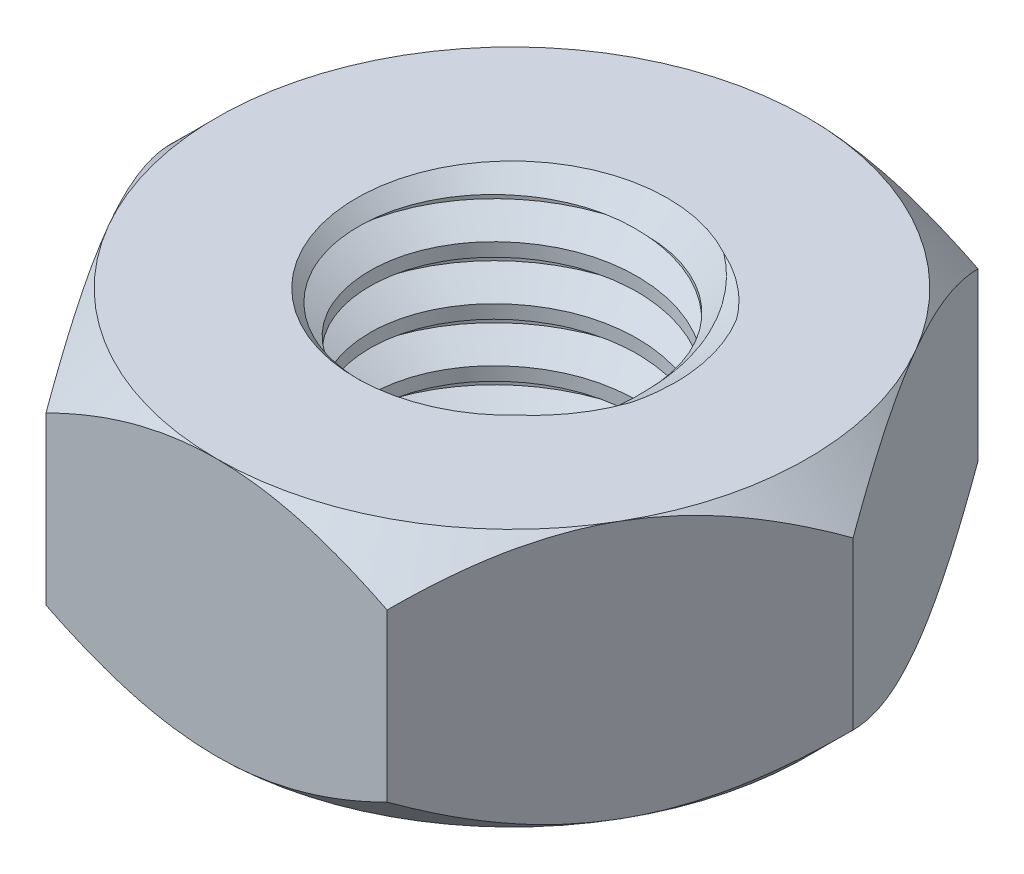
from build123d import *

# Parameters (mm, degrees)
BOSS_EXTRUDE1_DEPTH = 2.4
SKETCH2_OUTSIDE_W   = 21.774
SKETCH2_OUTSIDE_H   = 20.924
SKETCH2_OUTSIDE_R   = 2.75
CUT_EXTRUDE1_DEPTH  = 5.837957558
CUT_EXTRUDE1_DRAFT  = -45
SKETCH3_OUTSIDE_W   = 21.774
SKETCH3_OUTSIDE_H   = 20.924
SKETCH3_OUTSIDE_R   = 2.75
CUT_EXTRUDE2_DEPTH  = 5.837957558
CUT_EXTRUDE2_DRAFT  = -45
SKETCH4_R           = 1.25
CUT_EXTRUDE3_DEPTH  = 5.837957558
CHAMFER1_SIZE       = 0.2
THREAD1_PITCH       = 0.5


with BuildPart() as part:
    # Sketch1 → Boss-Extrude1 (new body)
    with BuildSketch(Plane(origin=(0, 0, 0), x_dir=(1, 0, 0), z_dir=(0, 1, 0))):
        Polygon((3.175426481, 0), (1.58771324, 2.75), (-1.58771324, 2.75), (-3.175426481, 0), (-1.58771324, -2.75), (1.58771324, -2.75), align=None)
    extrude(amount=BOSS_EXTRUDE1_DEPTH)


with BuildPart() as cut_extrude1_tool:
    # Sketch2 outside → Cut-Extrude1 (with draft: the straight prism first)
    with BuildSketch(Plane(origin=(0, 2.4, 0), x_dir=(1, 0, 0), z_dir=(0, 1, 0))):
        Rectangle(SKETCH2_OUTSIDE_W, SKETCH2_OUTSIDE_H)
        Circle(SKETCH2_OUTSIDE_R, mode=Mode.SUBTRACT)
    extrude(amount=-CUT_EXTRUDE1_DEPTH)
    # Cut-Extrude1: the draft: its side faces are tilted about the plane it starts from
    cut_extrude1_sides = [cut_extrude1_tool.faces().sort_by_distance(p)[0] for p in [
        (0, -0.518978779, 10.462),
        (10.887, -0.518978779, 0),
        (0, -0.518978779, -10.462),
        (-10.887, -0.518978779, 0),
        (-2.75, -0.518978779, 0),
    ]]
    draft(cut_extrude1_sides, Plane(origin=(0, 2.4, 0), x_dir=(1, 0, 0), z_dir=(0, 1, 0)), CUT_EXTRUDE1_DRAFT)


with BuildPart() as part_1:
    add(part.part)

    # Cut-Extrude1: cut by cut_extrude1_tool
    add(cut_extrude1_tool.part, mode=Mode.SUBTRACT)


with BuildPart() as cut_extrude2_tool:
    # Sketch3 outside → Cut-Extrude2 (with draft: the straight prism first)
    with BuildSketch(Plane.XZ):
        Rectangle(SKETCH3_OUTSIDE_W, SKETCH3_OUTSIDE_H)
        Circle(SKETCH3_OUTSIDE_R, mode=Mode.SUBTRACT)
    extrude(amount=-CUT_EXTRUDE2_DEPTH)
    # Cut-Extrude2: the draft: its side faces are tilted about the plane it starts from
    cut_extrude2_sides = [cut_extrude2_tool.faces().sort_by_distance(p)[0] for p in [
        (0, 2.918978779, -10.462),
        (10.887, 2.918978779, 0),
        (0, 2.918978779, 10.462),
        (-10.887, 2.918978779, 0),
        (-2.75, 2.918978779, 0),
    ]]
    draft(cut_extrude2_sides, Plane.XZ, CUT_EXTRUDE2_DRAFT)


with BuildPart() as part_2:
    add(part_1.part)

    # Cut-Extrude2: cut by cut_extrude2_tool
    add(cut_extrude2_tool.part, mode=Mode.SUBTRACT)

    # Sketch4 → Cut-Extrude3 (cut, through all)
    with BuildSketch(Plane(origin=(0, 2.4, 0), x_dir=(1, 0, 0), z_dir=(0, 1, 0))):
        with Locations(Location((0, 0, 0), (0, 0, 270))):
            Circle(SKETCH4_R)
    extrude(amount=-CUT_EXTRUDE3_DEPTH, mode=Mode.SUBTRACT)

    # Chamfer1
    chamfer1_edges = [part_2.edges().sort_by_distance(p)[0] for p in [
        (0, 0, -1.25),
        (0, 2.4, -1.25),
    ]]
    chamfer(chamfer1_edges, length=CHAMFER1_SIZE)

    # Thread1: the profile of Thread Profile1 profile screwed along a right-hand helix of 6.4 turns, 6 arcs to a turn; built about Z, then put on its axis
    thread1_z = Axis((0, 0, 0), (0, 0, 1))
    thread1_corners = [(1.2497, 0, -0.000173205), (1.520632938, 0, 0.156249999), (1.520632937, 0, 0.218749999), (1.2497, 0, 0.375173204)]
    with BuildLine(mode=Mode.PRIVATE) as thread1_profile:
        Line(thread1_corners[0], thread1_corners[1])
        Line(thread1_corners[1], thread1_corners[2])
        Line(thread1_corners[2], thread1_corners[3])
        Line(thread1_corners[3], thread1_corners[0])
    thread1_cap = Face(thread1_profile.wire())
    thread1_turn_angles = [0, 30, 60, 90, 120, 150, 180, 210, 240, 270, 300, 330, 360]
    thread1_turn_weights = [1, 0.8660254037844387, 1, 0.8660254037844387, 1, 0.8660254037844387, 1, 0.8660254037844387, 1, 0.8660254037844387, 1, 0.8660254037844387, 1]
    thread1_turn_rails = [Edge.make_bspline([Vector(p[0], p[1], 0).rotate(thread1_z, thread1_turn_angles[k]) / thread1_turn_weights[k] + Vector(0, 0, p[2] + THREAD1_PITCH * thread1_turn_angles[k] / 360) for k in range(13)], [0, 0, 0, 1, 1, 2, 2, 3, 3, 4, 4, 5, 5, 6, 6, 6], 2, thread1_turn_weights) for p in thread1_corners]
    thread1_turn_sides = [Face.make_surface_from_curves(thread1_turn_rails[p[0]], thread1_turn_rails[p[1]]) for p in [(0, 1), (1, 2), (2, 3), (3, 0)]]
    thread1_last_angles = [2160, 2190, 2220, 2250, 2280, 2292, 2304]
    thread1_last_weights = [1, 0.8660254037844387, 1, 0.8660254037844387, 1, 0.9781476007338072, 1]
    thread1_last_rails = [Edge.make_bspline([Vector(p[0], p[1], 0).rotate(thread1_z, thread1_last_angles[k]) / thread1_last_weights[k] + Vector(0, 0, p[2] + THREAD1_PITCH * thread1_last_angles[k] / 360) for k in range(7)], [0, 0, 0, 1, 1, 2, 2, 3, 3, 3], 2, thread1_last_weights) for p in thread1_corners]
    thread1_last_sides = [Face.make_surface_from_curves(thread1_last_rails[p[0]], thread1_last_rails[p[1]]) for p in [(0, 1), (1, 2), (2, 3), (3, 0)]]
    thread1 = Plane(origin=(0, -0.8, 0), x_dir=(1, 0, 0), z_dir=(0, 1, 0)) * Solid(Shell([*[p.moved(Location((0, 0, THREAD1_PITCH * i))) for i in range(6) for p in thread1_turn_sides], *thread1_last_sides, thread1_cap, thread1_cap.rotate(thread1_z, 2304).moved(Location((0, 0, THREAD1_PITCH * 2304 / 360)))]))
    add(thread1, mode=Mode.SUBTRACT)


solid = part_2.part
